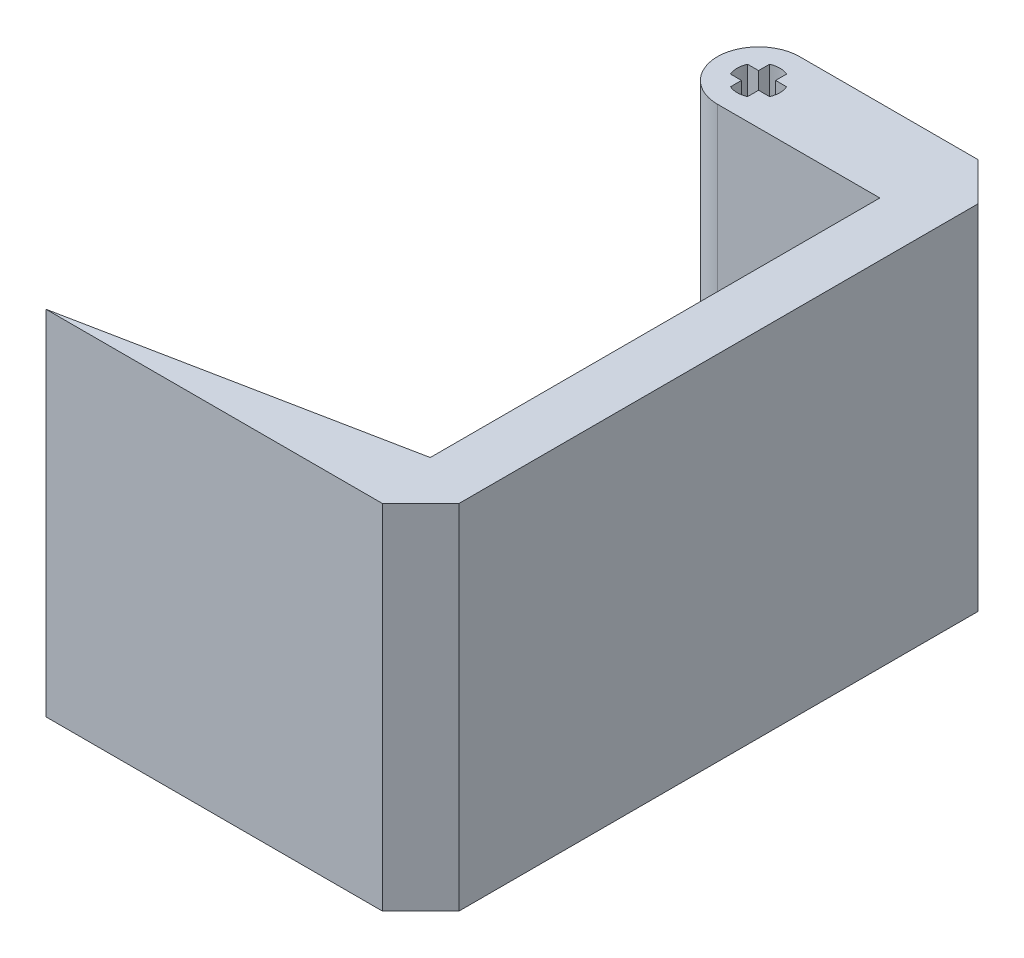
from build123d import *

# Parameters (mm, degrees)
BOSS_EXTRUDE6_DEPTH = 41.402
CUT_EXTRUDE1_DEPTH  = 82.162837432


with BuildPart() as part:
    # Sketch1 → Boss-Extrude6 (new body)
    with BuildSketch(Plane(origin=(0, 0, 0), x_dir=(1, 0, 0), z_dir=(0, 1, 0))):
        with BuildLine():
            Line((25.4, 4.826), (0, 4.826))
            ThreePointArc((0, 4.826), (-4.826, 0), (0, -4.826))
            Line((0, -4.826), (19.05, -4.826))
            Line((19.05, -4.826), (19.05, -57.550565519))
            Line((19.05, -57.550565519), (-18.542, -65.024))
            Line((-18.542, -65.024), (25.4, -65.024))
            Line((25.4, -65.024), (25.4, 4.826))
        make_face()
        with BuildLine():
            Line((-1, 1), (-2.291287847, 1))
            ThreePointArc((-2.291287847, 1), (-2.5, 0), (-2.291287847, -1))
            Line((-2.291287847, -1), (-1, -1))
            Line((-1, -1), (-1, -2.291287847))
            ThreePointArc((-1, -2.291287847), (0, -2.5), (1, -2.291287847))
            Line((1, -2.291287847), (1, -1))
            Line((1, -1), (2.291287847, -1))
            ThreePointArc((2.291287847, -1), (2.5, 0), (2.291287847, 1))
            Line((2.291287847, 1), (1, 1))
            Line((1, 1), (1, 2.291287847))
            ThreePointArc((1, 2.291287847), (0, 2.5), (-1, 2.291287847))
            Line((-1, 2.291287847), (-1, 1))
        make_face(mode=Mode.SUBTRACT)
    extrude(amount=BOSS_EXTRUDE6_DEPTH)

    # Sketch2 → Cut-Extrude1 (cut, through all)
    with BuildSketch(Plane(origin=(0, 0, 0), x_dir=(1, 0, 0), z_dir=(0, 1, 0))):
        Polygon((25.4, -60.533871939), (20.909871939, -65.024), (25.4, -65.024), align=None)
        Polygon((25.4, 0.335871939), (20.909871939, 4.826), (25.4, 4.826), align=None)
    extrude(amount=CUT_EXTRUDE1_DEPTH, mode=Mode.SUBTRACT)


solid = part.part
